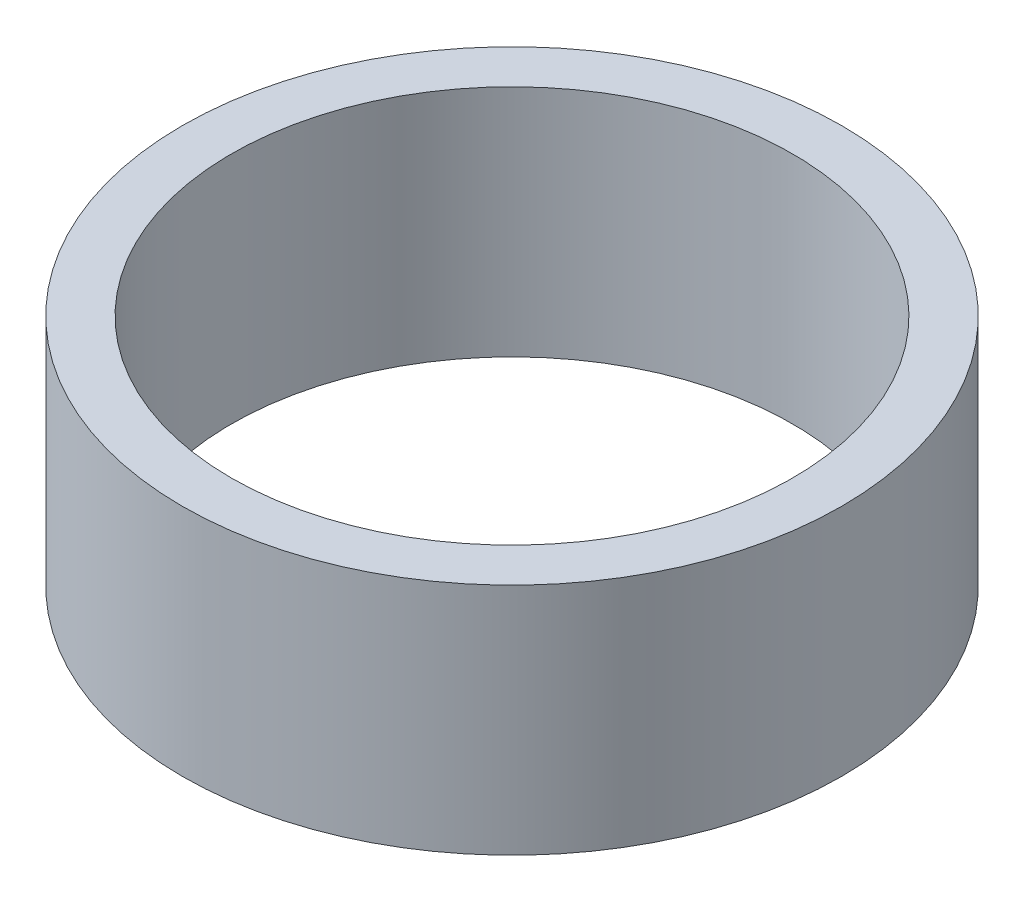
from build123d import *

# Parameters (mm, degrees)
SKETCH1_R           = 42.285
SKETCH1_R_2         = 36
BOSS_EXTRUDE1_DEPTH = 30
SKETCH2_R           = 40
SKETCH2_R_2         = 37.5
CUT_EXTRUDE1_DEPTH  = 4.6


with BuildPart() as part:
    # Sketch1 → Boss-Extrude1 (new body)
    with BuildSketch(Plane(origin=(0, 0, 0), x_dir=(1, 0, 0), z_dir=(0, 1, 0))):
        Circle(SKETCH1_R)
        Circle(SKETCH1_R_2, mode=Mode.SUBTRACT)
    extrude(amount=BOSS_EXTRUDE1_DEPTH)

    # Sketch2 → Cut-Extrude1 (cut)
    with BuildSketch(Plane.XZ):
        Circle(SKETCH2_R)
        Circle(SKETCH2_R_2, mode=Mode.SUBTRACT)
    extrude(amount=-CUT_EXTRUDE1_DEPTH, mode=Mode.SUBTRACT)


solid = part.part
